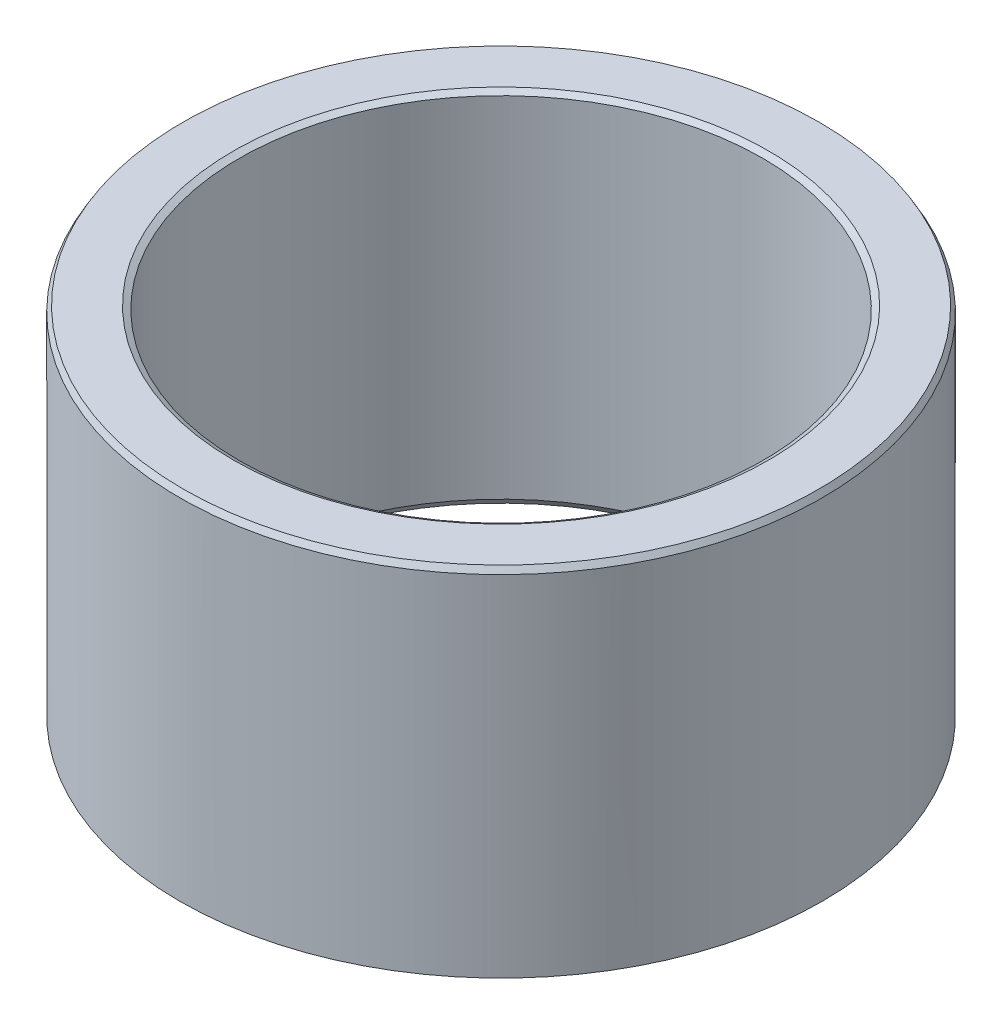
from build123d import *
from OCP.BRepFilletAPI import BRepFilletAPI_MakeChamfer

# Parameters (mm, degrees)
SKETCH1_R           = 52.5
BOSS_EXTRUDE1_DEPTH = 58.6155407
SKETCH2_R           = 42.783809997
CUT_EXTRUDE1_DEPTH  = 95.595357241
CHAMFER1_SIZE       = 0.960539857
CHAMFER1_SIZE2      = 0.554567945


with BuildPart() as part:
    # Sketch1 → Boss-Extrude1 (new body)
    with BuildSketch(Plane(origin=(0, 0, 0), x_dir=(1, 0, 0), z_dir=(0, 1, 0))):
        Circle(SKETCH1_R)
    extrude(amount=BOSS_EXTRUDE1_DEPTH)

    # Sketch2 → Cut-Extrude1 (cut, through all)
    with BuildSketch(Plane(origin=(0, 0, 0), x_dir=(1, 0, 0), z_dir=(0, 1, 0))):
        Circle(SKETCH2_R)
    extrude(amount=CUT_EXTRUDE1_DEPTH, mode=Mode.SUBTRACT)

    # Chamfer1: one chamfer whose edges measure the first distance from different faces: ONE call of the kernel's chamfer builder (chamfer() names one face for all edges)
    chamfer1_edges_1 = [part.edges().sort_by_distance(p)[0] for p in [
        (-42.783809997, 58.6155407, 0),
    ]]
    chamfer1_side_1 = [part.faces().sort_by_distance(p)[0] for p in [
        (-51.01507576, 58.6155407, 0),
    ]]
    chamfer1_edges_2 = [part.edges().sort_by_distance(p)[0] for p in [
        (-42.783809997, 0, 0),
    ]]
    chamfer1_side_2 = [part.faces().sort_by_distance(p)[0] for p in [
        (-42.783809997, 29.30777035, 0),
    ]]
    chamfer1_edges_3 = [part.edges().sort_by_distance(p)[0] for p in [
        (-52.5, 0, 0),
    ]]
    chamfer1_side_3 = [part.faces().sort_by_distance(p)[0] for p in [
        (-51.01507576, 0, 0),
    ]]
    chamfer1_edges_4 = [part.edges().sort_by_distance(p)[0] for p in [
        (-52.5, 58.6155407, 0),
    ]]
    chamfer1_side_4 = [part.faces().sort_by_distance(p)[0] for p in [
        (-52.5, 29.30777035, 0),
    ]]
    chamfer1 = BRepFilletAPI_MakeChamfer(part.part.solid().wrapped)
    for e in chamfer1_edges_1:
        chamfer1.Add(CHAMFER1_SIZE, CHAMFER1_SIZE2, e.wrapped, chamfer1_side_1[0].wrapped)  # the first distance lies on this face
    for e in chamfer1_edges_2:
        chamfer1.Add(CHAMFER1_SIZE, CHAMFER1_SIZE2, e.wrapped, chamfer1_side_2[0].wrapped)  # the first distance lies on this face
    for e in chamfer1_edges_3:
        chamfer1.Add(CHAMFER1_SIZE, CHAMFER1_SIZE2, e.wrapped, chamfer1_side_3[0].wrapped)  # the first distance lies on this face
    for e in chamfer1_edges_4:
        chamfer1.Add(CHAMFER1_SIZE, CHAMFER1_SIZE2, e.wrapped, chamfer1_side_4[0].wrapped)  # the first distance lies on this face
    add(Compound.cast(chamfer1.Shape()), mode=Mode.REPLACE)


solid = part.part
